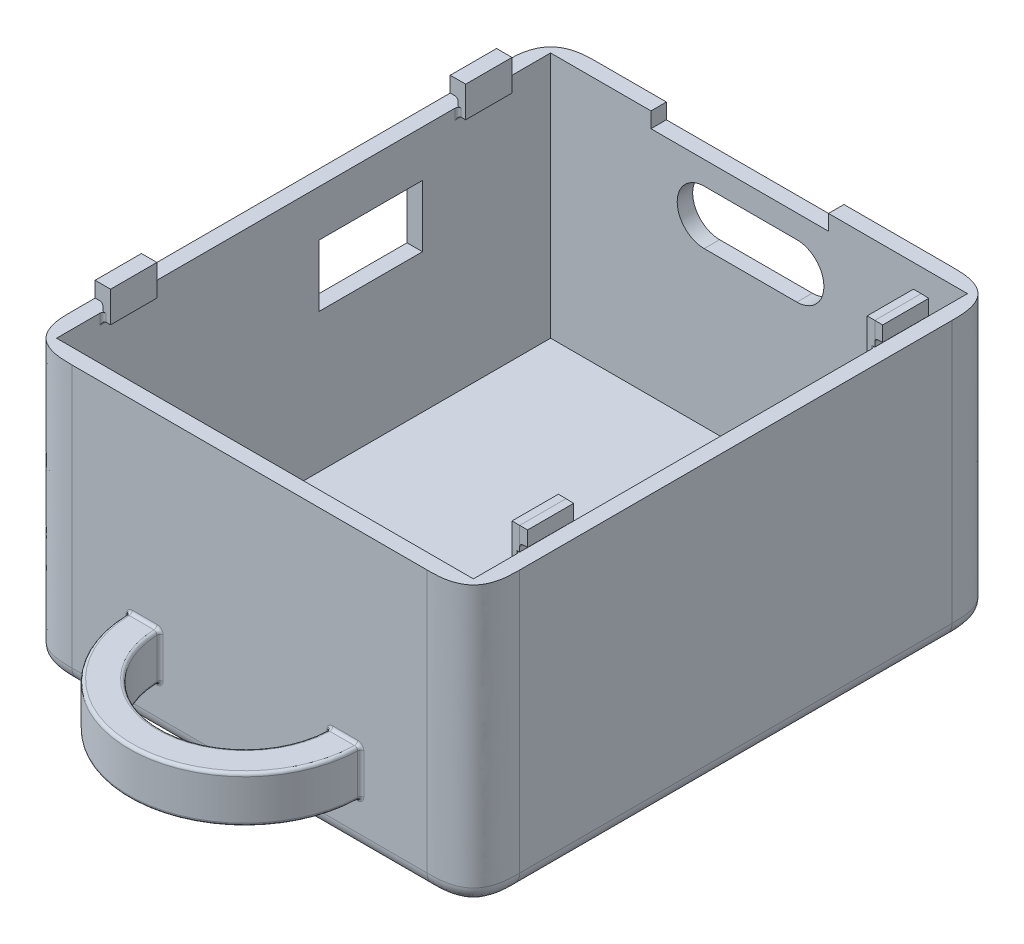
from build123d import *

# Parameters (mm, degrees)
SKETCH1_W              = 29
SKETCH1_H              = 34
BOTTOM_EXTRUDE_DEPTH   = 18
SID_CORNER_FILLET_SIZE = 3
BOTTOM_FILLET_R        = 1
SKETCH2_W              = 27
SKETCH2_H              = 32
CUT_EXTRUDE1_DEPTH     = 16
BOSS_EXTRUDE1_DEPTH    = 3
FILLET1_R              = 0.2
CUT_USB_REACH          = 157.318
SKETCH22_W             = 11.5
SKETCH22_H             = 1
SKETCH23_W             = 6.7
SKETCH23_H             = 4
CUT_BT_DEPTH           = 1
SKETCH24_W             = 3
SKETCH24_H             = 2
BOSS_CLIP_DEPTH        = 0.5
SKETCH26_W             = 3
SKETCH26_H             = 1
BOSS_CLIPEXT_DEPTH     = 0.5
BOSS_CLIPEXT_TAPER     = 1
FILLET2_R              = 0.2
LPATTERN2_COUNT        = 2
LPATTERN2_PITCH        = 23
FILLET2_OF_LPATTERN2_R = 0.2
SKETCH27_W             = 3
SKETCH27_H             = 2
BOSS_CLIP1_DEPTH       = 0.5
SKETCH28_W             = 3
SKETCH28_H             = 1
BOSS_CLIPEXT1_DEPTH    = 0.5
FILLET4_R              = 0.2
LPATTERN4_COUNT        = 2
LPATTERN4_PITCH        = 23
FILLET4_OF_LPATTERN4_R = 0.2


with BuildPart() as part:
    # Sketch1 → Bottom-Extrude (new body)
    with BuildSketch(Plane(origin=(0, 0, 0), x_dir=(1, 0, 0), z_dir=(0, 1, 0))):
        with Locations((-134.084269663, 79.775280899)):
            Rectangle(SKETCH1_W, SKETCH1_H)
    extrude(amount=BOTTOM_EXTRUDE_DEPTH)

    # Sid_Corner-Fillet
    # a fillet whose section is not a circle: 3 mm, written as the material it takes off along each edge
    with BuildSketch(Plane(origin=(-119.584269663, -7.5, -62.775280899), x_dir=(0, 0, -1), z_dir=(0, 1, 0)), Plane(origin=(-148.584269663, -7.5, -62.775280899), x_dir=(1, 0, 0), z_dir=(0, 1, 0)), Plane(origin=(-119.584269663, -7.5, -96.775280899), x_dir=(-1, 0, 0), z_dir=(0, 1, 0))) as sid_corner_fillet_piece_1:
        with BuildLine():
            add(Edge.make_bspline([(SID_CORNER_FILLET_SIZE, 0), (SID_CORNER_FILLET_SIZE * 0.831801948466, 0), (SID_CORNER_FILLET_SIZE * 0.663603896932, 0), (SID_CORNER_FILLET_SIZE * 0.292893218813, SID_CORNER_FILLET_SIZE * 0.0716919198361), (SID_CORNER_FILLET_SIZE * 0.0716919198361, SID_CORNER_FILLET_SIZE * 0.292893218813), (0, SID_CORNER_FILLET_SIZE * 0.663603896932), (0, SID_CORNER_FILLET_SIZE * 0.831801948466), (0, SID_CORNER_FILLET_SIZE)], knots=[0, 0, 0, 0, 0, 0, 0.5, 0.5, 1, 1, 1, 1, 1, 1], degree=5))
            Line((0, SID_CORNER_FILLET_SIZE), (0, 0))
            Line((0, 0), (SID_CORNER_FILLET_SIZE, 0))
        make_face()
    extrude(amount=33, mode=Mode.SUBTRACT)
    with BuildSketch(Plane(origin=(-148.584269663, -7.5, -96.775280899), x_dir=(1, 0, 0), z_dir=(0, 1, 0))) as sid_corner_fillet_piece_2:
        with BuildLine():
            add(Edge.make_bspline([(SID_CORNER_FILLET_SIZE, 0), (SID_CORNER_FILLET_SIZE * 0.831801948466, 0), (SID_CORNER_FILLET_SIZE * 0.663603896932, 0), (SID_CORNER_FILLET_SIZE * 0.292893218813, -SID_CORNER_FILLET_SIZE * 0.0716919198361), (SID_CORNER_FILLET_SIZE * 0.0716919198361, -SID_CORNER_FILLET_SIZE * 0.292893218813), (0, -SID_CORNER_FILLET_SIZE * 0.663603896932), (0, -SID_CORNER_FILLET_SIZE * 0.831801948466), (0, -SID_CORNER_FILLET_SIZE)], knots=[0, 0, 0, 0, 0, 0, 0.5, 0.5, 1, 1, 1, 1, 1, 1], degree=5))
            Line((0, -SID_CORNER_FILLET_SIZE), (0, 0))
            Line((0, 0), (SID_CORNER_FILLET_SIZE, 0))
        make_face()
    extrude(amount=33, mode=Mode.SUBTRACT)

    # Bottom-Fillet
    bottom_fillet_edges = [part.edges().sort_by_distance(p)[0] for p in [
        (-134.084269663, 0, -96.775280899),
        (-148.584269663, 0, -79.775280899),
        (-134.084269663, 0, -62.775280899),
        (-119.584269663, 0, -79.775280899),
        (-120.243279405, 0, -96.116271157),
        (-147.925259921, 0, -96.116271157),
        (-147.925259921, 0, -63.434290641),
        (-120.243279405, 0, -63.434290641),
    ]]
    fillet(bottom_fillet_edges, radius=BOTTOM_FILLET_R)

    # Sketch2 → Cut-Extrude1 (cut)
    with BuildSketch(Plane(origin=(0, 18, 0), x_dir=(1, 0, 0), z_dir=(0, 1, 0))):
        with Locations((-134.084269663, 79.775280899)):
            Rectangle(SKETCH2_W, SKETCH2_H)
    extrude(amount=-CUT_EXTRUDE1_DEPTH, mode=Mode.SUBTRACT)

    # Sketch21 → Boss-Extrude1 (add)
    with BuildSketch(Plane(origin=(0, 3, 0), x_dir=(-1, 0, 0), z_dir=(0, -1, 0))):
        with BuildLine():
            ThreePointArc((126.880155272, 62.775280899), (134.380155272, 55.275280899), (141.880155272, 62.775280899))
            Line((141.880155272, 62.775280899), (139.880155272, 62.775280899))
            ThreePointArc((139.880155272, 62.775280899), (134.380155272, 57.275280899), (128.880155272, 62.775280899))
            Line((128.880155272, 62.775280899), (126.880155272, 62.775280899))
        make_face()
    extrude(amount=-BOSS_EXTRUDE1_DEPTH)

    # Fillet1
    fillet1_edges = [part.edges().sort_by_distance(p)[0] for p in [
        (-134.380155272, 3, -57.275280899),
        (-128.880155272, 4.5, -62.775280899),
        (-140.880155272, 6, -62.775280899),
        (-139.880155272, 4.5, -62.775280899),
        (-134.380155272, 6, -55.275280899),
        (-141.880155272, 4.5, -62.775280899),
        (-127.880155272, 6, -62.775280899),
        (-126.880155272, 4.5, -62.775280899),
        (-134.380155272, 6, -57.275280899),
        (-127.880155272, 3, -62.775280899),
        (-134.380155272, 3, -55.275280899),
        (-140.880155272, 3, -62.775280899),
    ]]
    fillet(fillet1_edges, radius=FILLET1_R)

    # Sketch22 → Cut-USB (cut, up to next)
    with BuildSketch(Plane(origin=(0, 0, -96.775280899), x_dir=(-1, 0, 0), z_dir=(0, 0, -1)), mode=Mode.PRIVATE) as cut_usb_sk1:
        with BuildLine():
            Line((131.634269663, 15.5), (137.634269663, 15.5))
            ThreePointArc((137.634269663, 15.5), (139.384269663, 13.75), (137.634269663, 12))
            Line((137.634269663, 12), (131.634269663, 12))
            ThreePointArc((131.634269663, 12), (129.884269663, 13.75), (131.634269663, 15.5))
        make_face()
    cut_usb_tool1 = extrude(cut_usb_sk1.sketch, amount=-CUT_USB_REACH, mode=Mode.PRIVATE) & part.part
    # Sketch22 → Cut-USB (cut, up to next)
    with BuildSketch(Plane(origin=(0, 0, -96.775280899), x_dir=(-1, 0, 0), z_dir=(0, 0, -1)), mode=Mode.PRIVATE) as cut_usb_sk2:
        with Locations((135.334269663, 17.5)):
            Rectangle(SKETCH22_W, SKETCH22_H)
    cut_usb_tool2 = extrude(cut_usb_sk2.sketch, amount=-CUT_USB_REACH, mode=Mode.PRIVATE) & part.part
    add(cut_usb_tool1.solids().sort_by_distance((-134.63427, 13.75, -96.775281))[0], mode=Mode.SUBTRACT)
    add(cut_usb_tool2.solids().sort_by_distance((-135.33427, 17.5, -96.775281))[0], mode=Mode.SUBTRACT)

    # Sketch23 → Cut-BT (cut)
    with BuildSketch(Plane.ZY.offset(148.584269663)):
        with Locations((-84.125280899, 13)):
            Rectangle(SKETCH23_W, SKETCH23_H)
    extrude(amount=-CUT_BT_DEPTH, mode=Mode.SUBTRACT)

    # Sketch24 → Boss-Clip (add)
    with BuildSketch(Plane.ZY.offset(120.584269663)):
        with Locations((-68.275280899, 18.5)):
            Rectangle(SKETCH24_W, SKETCH24_H)
    boss_clip = extrude(amount=BOSS_CLIP_DEPTH)

    # Sketch26 → Boss-ClipExt (add)
    with BuildSketch(Plane(origin=(-120.584269663, 0, 0), x_dir=(0, 0, -1), z_dir=(1, 0, 0))):
        with Locations((68.275280899, 19)):
            Rectangle(SKETCH26_W, SKETCH26_H)
    boss_clipext = extrude(amount=BOSS_CLIPEXT_DEPTH, taper=BOSS_CLIPEXT_TAPER)

    # Fillet2
    fillet2_edges = [part.edges().sort_by_distance(p)[0] for p in [
        (-120.584269663, 17.75, -69.775280899),
        (-120.584269663, 17.75, -66.775280899),
        (-120.584269663, 17.5, -68.275280899),
        (-120.584269663, 18.5, -68.275280899),
    ]]
    fillet(fillet2_edges, radius=FILLET2_R)

    # LPattern2: Boss-Clip, Boss-ClipExt ×2
    with Locations(*[(0, 0, -i * LPATTERN2_PITCH) for i in range(1, LPATTERN2_COUNT)]):
        add(boss_clip)
        add(boss_clipext)

    # Fillet2 of LPattern2
    fillet2_of_lpattern2_edges = [part.edges().sort_by_distance(p)[0] for p in [
        (-120.584269663, 17.75, -92.775280899),
        (-120.584269663, 17.75, -89.775280899),
        (-120.584269663, 17.5, -91.275280899),
        (-120.584269663, 18.5, -91.275280899),
    ]]
    fillet(fillet2_of_lpattern2_edges, radius=FILLET2_OF_LPATTERN2_R)

    # Sketch27 → Boss-Clip1 (add)
    with BuildSketch(Plane(origin=(-147.584269663, 0, 0), x_dir=(0, 0, -1), z_dir=(1, 0, 0))):
        with Locations((68.275280899, 18.5)):
            Rectangle(SKETCH27_W, SKETCH27_H)
    boss_clip1 = extrude(amount=BOSS_CLIP1_DEPTH)

    # Sketch28 → Boss-ClipExt1 (add)
    with BuildSketch(Plane.ZY.offset(147.584269663)):
        with Locations((-68.275280899, 19)):
            Rectangle(SKETCH28_W, SKETCH28_H)
    boss_clipext1 = extrude(amount=BOSS_CLIPEXT1_DEPTH)

    # Fillet4
    fillet4_edges = [part.edges().sort_by_distance(p)[0] for p in [
        (-147.584269663, 18.5, -68.275280899),
        (-147.584269663, 17.75, -69.775280899),
        (-147.584269663, 17.5, -68.275280899),
        (-147.584269663, 17.75, -66.775280899),
    ]]
    fillet(fillet4_edges, radius=FILLET4_R)

    # LPattern4: Boss-Clip1, Boss-ClipExt1 ×2
    with Locations(*[(0, 0, -i * LPATTERN4_PITCH) for i in range(1, LPATTERN4_COUNT)]):
        add(boss_clip1)
        add(boss_clipext1)

    # Fillet4 of LPattern4
    fillet4_of_lpattern4_edges = [part.edges().sort_by_distance(p)[0] for p in [
        (-147.584269663, 18.5, -91.275280899),
        (-147.584269663, 17.75, -92.775280899),
        (-147.584269663, 17.5, -91.275280899),
        (-147.584269663, 17.75, -89.775280899),
    ]]
    fillet(fillet4_of_lpattern4_edges, radius=FILLET4_OF_LPATTERN4_R)


solid = part.part
